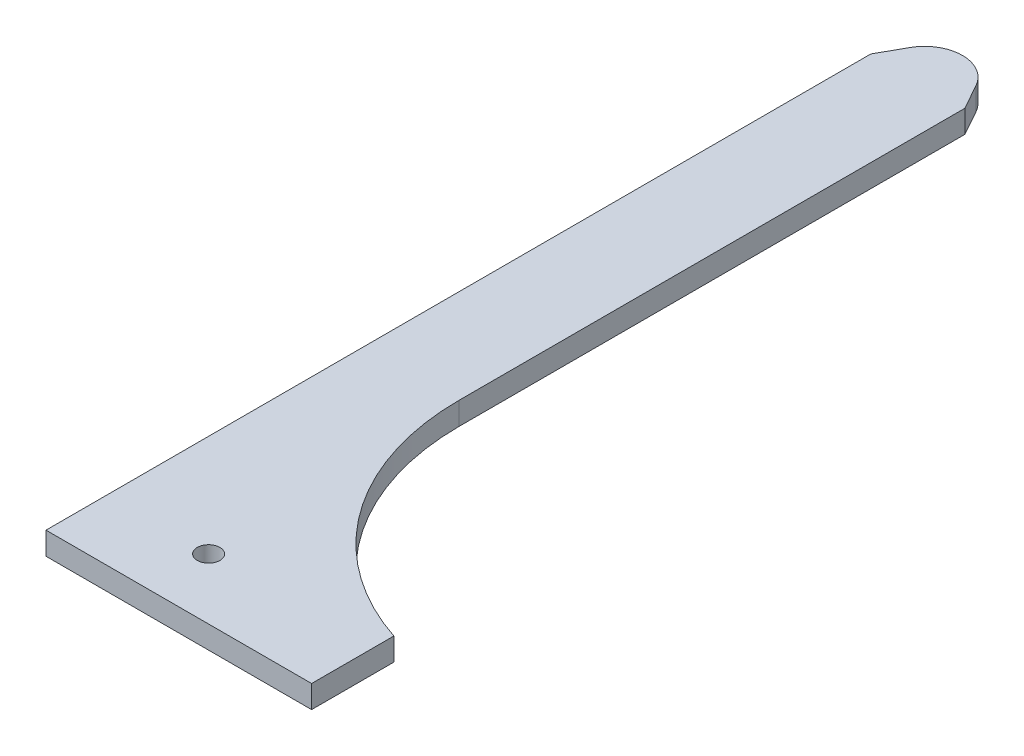
from build123d import *

# Parameters (mm, degrees)
SKETCH_1_R      = 1.5
EXTRUDE_1_DEPTH = 3
FILLET_4_R      = 5


with BuildPart() as part:
    # 草图1 → 凸台-拉伸1 (new body)
    with BuildSketch(Plane(origin=(0, 0, 0), x_dir=(1, 0, 0), z_dir=(0, 1, 0))):
        with BuildLine():
            Line((-45.46, 67), (-45.46, -42.262061372))
            Line((-45.46, -42.262061372), (-10.274300832, -42.262061372))
            Line((-10.274300832, -42.262061372), (-10.274300832, -31.359826887))
            ThreePointArc((-10.274300832, -31.359826887), (-26.721264261, -19.364246339), (-33, 0))
            Line((-33, 0), (-33, 67))
            Line((-33, 67), (-39.23, 78.185494034))
            Line((-39.23, 78.185494034), (-45.46, 67))
        make_face()
        with Locations((-31.96, -34.222061372)):
            Circle(SKETCH_1_R, mode=Mode.SUBTRACT)
    extrude(amount=EXTRUDE_1_DEPTH)

    # 圆角4
    fillet_4_edges = [part.edges().sort_by_distance(p)[0] for p in [
        (-39.23, 1.5, -78.185494034),
    ]]
    fillet(fillet_4_edges, radius=FILLET_4_R)


solid = part.part
